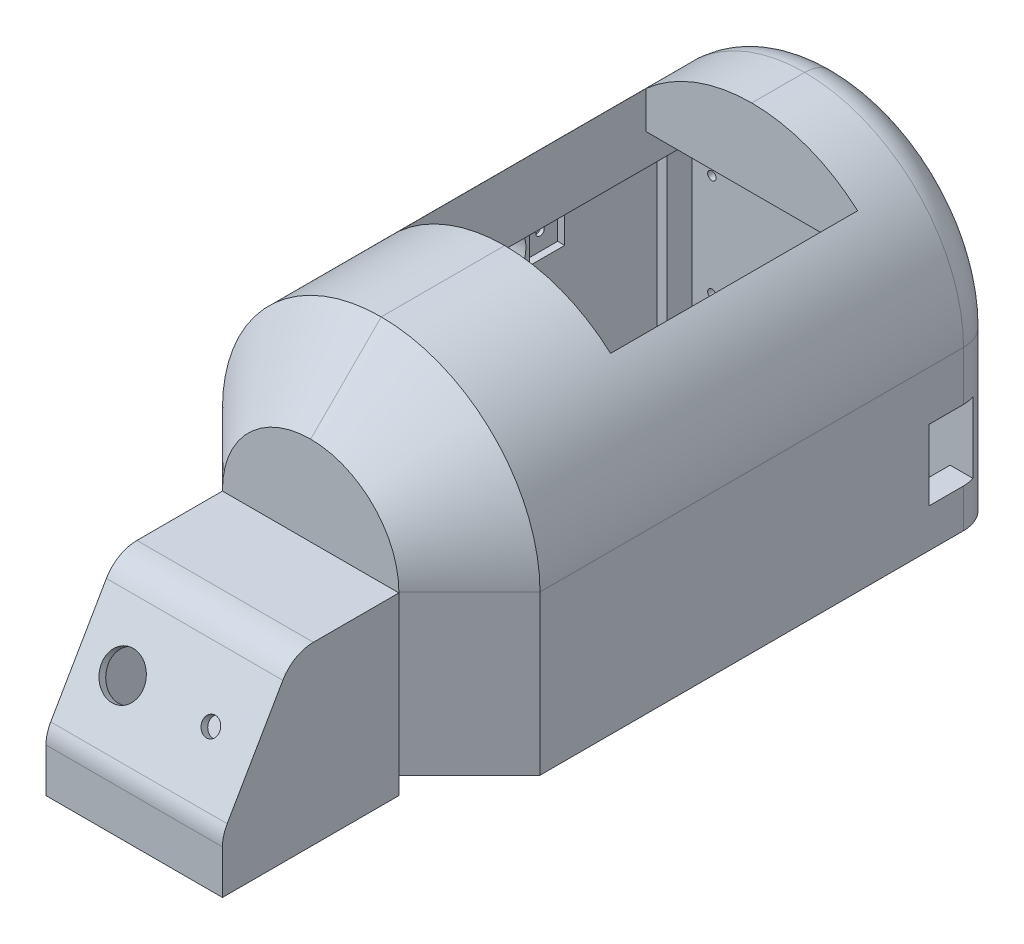
from build123d import *

# Parameters (mm, degrees)
SCHIZZO1_W                             = 90
SCHIZZO1_H                             = 150
ESTRUSIONE_ESTRUSIONE1_DEPTH           = 90
SCHIZZO4_W                             = 60
SCHIZZO4_H                             = 70
TAGLIO_ESTRUSIONE2_DEPTH               = 90
RACCORDO5_R                            = 45
RACCORDO6_R                            = 45
SMUSSO2_SIZE                           = 20
SCHIZZO7_W                             = 50
SCHIZZO7_H                             = 44.753189799
ESTRUSIONE_ESTRUSIONE2_DEPTH           = 50
SMUSSO3_SIZE                           = 20
SMUSSO3_SIZE2                          = 34.641016151
RACCORDO7_R                            = 10
RACCORDO8_R                            = 10
SCHIZZO9_W                             = 50
SCHIZZO9_H                             = 50
ESTRUSIONE_ESTRUSIONE3_DEPTH           = 5
RACCORDO9_R                            = 10
SCHIZZO13_W                            = 45
SCHIZZO13_H                            = 38.415996799
TAGLIO_ESTRUSIONE3_DEPTH               = 79.978264331
SCHIZZO14_W                            = 117.844501366
SCHIZZO14_H                            = 59.041021869
TAGLIO_ESTRUSIONE4_DEPTH               = 8
SCHIZZO18_R                            = 5
TAGLIO_ESTRUSIONE5_DEPTH               = 9
SCHIZZO16_W                            = 4
SCHIZZO16_H                            = 20
TAGLIO_ESTRUSIONE7_DEPTH               = 2
SCHIZZO23_W                            = 76
SCHIZZO23_H                            = 117.844501366
TAGLIO_ESTRUSIONE8_DEPTH               = 38
FORO_PER_VITE_M2_2_D                   = 2.4
FORO_PER_VITE_M2_2_DEPTH               = 4
FORO_PER_VITE_M4_1_D                   = 4.5
FORO_PER_VITE_M4_1_DEPTH               = 10
SCHIZZO29_W                            = 60
SCHIZZO29_H                            = 11.209863528
TAGLIO_ESTRUSIONE9_DEPTH               = 30
SCHIZZO30_W                            = 70
SCHIZZO30_H                            = 52
TAGLIO_ESTRUSIONE10_DEPTH              = 7
FORO_PER_VITE_M2_3_D                   = 2.4
FORO_PER_VITE_M2_3_DEPTH               = 4
FORO_PER_VITE_M2_3_TIP                 = 0.721032743
SCHIZZO33_W                            = 13
SCHIZZO33_H                            = 20
TAGLIO_ESTRUSIONE11_DEPTH              = 36
SCHIZZO36_W                            = 46.07976418
SCHIZZO36_H                            = 28.262497783
TAGLIO_ESTRUSIONE12_DEPTH              = 28
ESTRUSIONE_ESTRUSIONE4_REACH           = 170.388
SCHIZZO38_R                            = 6
SCHIZZO38_R_2                          = 2.5
TAGLIO_ESTRUSIONE13_DEPTH              = 28
SCHIZZO39_R                            = 9
SCHIZZO39_W                            = 10
SCHIZZO39_H                            = 10
TAGLIO_ESTRUSIONE14_DEPTH              = 2
SCHIZZO40_W                            = 32
SCHIZZO40_H                            = 10
TAGLIO_ESTRUSIONE15_DEPTH              = 10
SCHIZZO42_R                            = 4
TAGLIO_ESTRUSIONE16_DEPTH              = 3
FORO_SVASATO_PER_VITE_M2_3_D           = 2.4
FORO_SVASATO_PER_VITE_M2_3_DEPTH       = 6
FORO_SVASATO_PER_VITE_M2_3_CSINK_D     = 4.4
FORO_SVASATO_PER_VITE_M2_3_CSINK_ANGLE = 90
FORO_SVASATO_PER_VITE_M2_3_TIP         = 0.721032743
TAGLIO_ESTRUSIONE18_DEPTH              = 7
SCHIZZO53_R                            = 9
TAGLIO_ESTRUSIONE19_DEPTH              = 2.75
SCHIZZO54_W                            = 60
SCHIZZO54_H                            = 36.634637838
TAGLIO_ESTRUSIONE20_DEPTH              = 24.75


with BuildPart() as part:
    # Schizzo1 → Estrusione-Estrusione1 (new body)
    with BuildSketch(Plane(origin=(0, 0, 0), x_dir=(1, 0, 0), z_dir=(0, 1, 0))):
        Rectangle(SCHIZZO1_W, SCHIZZO1_H)
    extrude(amount=ESTRUSIONE_ESTRUSIONE1_DEPTH)

    # Schizzo4 → Taglio-Estrusione2 (cut)
    with BuildSketch(Plane(origin=(0, 90, 0), x_dir=(1, 0, 0), z_dir=(0, 1, 0))):
        with Locations((0, 15)):
            Rectangle(SCHIZZO4_W, SCHIZZO4_H)
    extrude(amount=-TAGLIO_ESTRUSIONE2_DEPTH, mode=Mode.SUBTRACT)

    # Raccordo5
    # the kernel refuses this fillet: 45 mm, written as the material it takes off along each edge
    with BuildSketch(Plane(origin=(-45, 90, -187.5), x_dir=(0, -1, 0), z_dir=(0, 0, 1))) as raccordo5_piece_1:
        with BuildLine():
            CenterArc((RACCORDO5_R, RACCORDO5_R), RACCORDO5_R, 180, 90)
            Line((0, RACCORDO5_R), (0, 0))
            Line((0, 0), (RACCORDO5_R, 0))
        make_face()
    extrude(amount=375, mode=Mode.SUBTRACT)

    # Raccordo6
    # the kernel refuses this fillet: 45 mm, written as the material it takes off along each edge
    with BuildSketch(Plane(origin=(45, 90, 187.5), x_dir=(0, -1, 0), z_dir=(0, 0, -1))) as raccordo6_piece_1:
        with BuildLine():
            CenterArc((RACCORDO6_R, RACCORDO6_R), RACCORDO6_R, 180, 90)
            Line((0, RACCORDO6_R), (0, 0))
            Line((0, 0), (RACCORDO6_R, 0))
        make_face()
    extrude(amount=375, mode=Mode.SUBTRACT)

    # Smusso2
    smusso2_edges = [part.edges().sort_by_distance(p)[0] for p in [
        (-45, 22.5, 75),
        (0, 90, 75),
        (45, 22.5, 75),
        (0, 90, 75),
    ]]
    chamfer(smusso2_edges, length=SMUSSO2_SIZE)

    # Schizzo7 → Estrusione-Estrusione2 (add)
    with BuildSketch(Plane.XY.offset(75)):
        with Locations((0, 22.3765949)):
            Rectangle(SCHIZZO7_W, SCHIZZO7_H)
    extrude(amount=ESTRUSIONE_ESTRUSIONE2_DEPTH)

    # Smusso3
    smusso3_edges = [part.edges().sort_by_distance(p)[0] for p in [
        (0, 44.753189799, 125),
    ]]
    smusso3_side = [part.faces().sort_by_distance(p)[0] for p in [
        (0, 44.753189799, 100),
    ]]
    chamfer(smusso3_edges, length=SMUSSO3_SIZE, length2=SMUSSO3_SIZE2, reference=smusso3_side[0])

    # Raccordo7
    raccordo7_edges = [part.edges().sort_by_distance(p)[0] for p in [
        (0, 44.753189799, 105),
    ]]
    fillet(raccordo7_edges, radius=RACCORDO7_R)

    # Raccordo8
    raccordo8_edges = [part.edges().sort_by_distance(p)[0] for p in [
        (0, 10.112173648, 125),
    ]]
    fillet(raccordo8_edges, radius=RACCORDO8_R)

    # Schizzo9 → Estrusione-Estrusione3 (add)
    with BuildSketch(Plane.XZ):
        with Locations((0, 100)):
            Rectangle(SCHIZZO9_W, SCHIZZO9_H)
    extrude(amount=ESTRUSIONE_ESTRUSIONE3_DEPTH)

    # Raccordo9
    raccordo9_edges = [part.edges().sort_by_distance(p)[0] for p in [
        (-45, 22.5, -75),
        (0, 90, -75),
        (45, 22.5, -75),
        (0, 90, -75),
    ]]
    fillet(raccordo9_edges, radius=RACCORDO9_R)

    # Schizzo13 → Taglio-Estrusione3 (cut)
    with BuildSketch(Plane(origin=(0, 0, 20), x_dir=(-1, 0, 0), z_dir=(0, 0, -1))):
        with Locations((0, 19.2079984)):
            Rectangle(SCHIZZO13_W, SCHIZZO13_H)
    extrude(amount=-TAGLIO_ESTRUSIONE3_DEPTH, mode=Mode.SUBTRACT)

    # Schizzo14 → Taglio-Estrusione4 (cut)
    with BuildSketch(Plane.ZY.offset(-30)):
        with Locations((-2.287612845, 29.520510935)):
            Rectangle(SCHIZZO14_W, SCHIZZO14_H)
    taglio_estrusione4 = extrude(amount=-TAGLIO_ESTRUSIONE4_DEPTH, mode=Mode.SUBTRACT)

    # Specchia1: Taglio-Estrusione4 across plane
    add(taglio_estrusione4.mirror(Plane(origin=(0, 0, 0), x_dir=(0, 0, 1), z_dir=(1, 0, 0))), mode=Mode.SUBTRACT)

    # Schizzo18 → Taglio-Estrusione5 (cut)
    with BuildSketch(Plane.ZY.offset(-30)):
        with Locations((-15, 48.541019662)):
            Circle(SCHIZZO18_R)
    extrude(amount=-TAGLIO_ESTRUSIONE5_DEPTH, mode=Mode.SUBTRACT)

    # Schizzo16 → Taglio-Estrusione7 (cut)
    with BuildSketch(Plane.XZ.offset(-59.041021869)):
        with Locations((32, -15)):
            Rectangle(SCHIZZO16_W, SCHIZZO16_H)
    extrude(amount=-TAGLIO_ESTRUSIONE7_DEPTH, mode=Mode.SUBTRACT)

    # Schizzo23 → Taglio-Estrusione8 (cut)
    with BuildSketch(Plane.XZ):
        with Locations((0, -2.287612845)):
            Rectangle(SCHIZZO23_W, SCHIZZO23_H)
    extrude(amount=-TAGLIO_ESTRUSIONE8_DEPTH, mode=Mode.SUBTRACT)

    # Foro per Vite M2-2
    with Locations(Plane(origin=(0, 0, 0), x_dir=(-1, 0, 0), z_dir=(0, -1, 0))):
        with Locations((40, 67), (30, -61.514718626), (-30, -61.514718626), (-40, 67), (-41.5, 5), (41.5, 5)):
            Hole(FORO_PER_VITE_M2_2_D / 2, depth=FORO_PER_VITE_M2_2_DEPTH)

    # Foro per Vite M4-1
    with Locations(Plane(origin=(0, -5, 84.779580177), x_dir=(0, 0, -1), z_dir=(0, -1, 0))):
        with Locations((0, 0)):
            Hole(FORO_PER_VITE_M4_1_D / 2, depth=FORO_PER_VITE_M4_1_DEPTH)

    # Schizzo29 → Taglio-Estrusione9 (cut)
    with BuildSketch(Plane.XZ.offset(-38)):
        with Locations((0, -55.604931764)):
            Rectangle(SCHIZZO29_W, SCHIZZO29_H)
    extrude(amount=-TAGLIO_ESTRUSIONE9_DEPTH, mode=Mode.SUBTRACT)

    # Schizzo30 → Taglio-Estrusione10 (cut)
    with BuildSketch(Plane.XY.offset(-61.209863528)):
        with Locations((3, 29.778767455)):
            Rectangle(SCHIZZO30_W, SCHIZZO30_H)
    extrude(amount=-TAGLIO_ESTRUSIONE10_DEPTH, mode=Mode.SUBTRACT)

    # Foro per Vite M2-3
    with Locations(Plane.XY.offset(-68.209863528)):
        with Locations((-29.5, 48.278767455), (-29.5, 19.278767455), (22.5, 6.278767455), (22.5, 53.278767455)):
            Hole(FORO_PER_VITE_M2_3_D / 2, depth=FORO_PER_VITE_M2_3_DEPTH)
            with Locations((0, 0, -(FORO_PER_VITE_M2_3_DEPTH + FORO_PER_VITE_M2_3_TIP / 2))):  # 118° drill point
                Cone(0, FORO_PER_VITE_M2_3_D / 2, FORO_PER_VITE_M2_3_TIP, mode=Mode.SUBTRACT)

    # Schizzo33 → Taglio-Estrusione11 (cut)
    with BuildSketch(Plane.ZY.offset(-38)):
        with Locations((-61.709863528, 21)):
            Rectangle(SCHIZZO33_W, SCHIZZO33_H)
    extrude(amount=-TAGLIO_ESTRUSIONE11_DEPTH, mode=Mode.SUBTRACT)

    # Schizzo36 → Taglio-Estrusione12 (cut)
    with BuildSketch(Plane(origin=(0, 56.654631148, 98.128699633), x_dir=(1, 0, 0), z_dir=(0, 0.5000000000000012, 0.8660254037844378))):
        with Locations((0, -35.289606117)):
            Rectangle(SCHIZZO36_W, SCHIZZO36_H)
    extrude(amount=-TAGLIO_ESTRUSIONE12_DEPTH, mode=Mode.SUBTRACT)

    # Schizzo37 → Estrusione-Estrusione4 (add, up to next)
    with BuildSketch(Plane.ZY.offset(-23.03988209), mode=Mode.PRIVATE) as estrusione_estrusione4_sk1:
        Polygon((122.839127138, 13.854915234), (108.707878246, 38.330956288), (106.809101084, 37.234696782), (120.940349975, 12.758655728), align=None)
    estrusione_estrusione4_tool1 = extrude(estrusione_estrusione4_sk1.sketch, amount=ESTRUSIONE_ESTRUSIONE4_REACH, mode=Mode.PRIVATE) - part.part
    add(estrusione_estrusione4_tool1.solids().sort_by_distance((23.039882, 25.544806, 114.824114))[0])

    # Schizzo38 → Taglio-Estrusione13 (cut)
    with BuildSketch(Plane(origin=(0, 56.654631148, 98.128699633), x_dir=(1, 0, 0), z_dir=(0, 0.5000000000000013, 0.8660254037844379))):
        with Locations(Location((-12.5, -35.289606117, 0), (0, 0, 270))):
            Circle(SCHIZZO38_R)
        with Locations(Location((12.5, -35.289606117, 0), (0, 0, 270))):
            Circle(SCHIZZO38_R_2)
    extrude(amount=-TAGLIO_ESTRUSIONE13_DEPTH, mode=Mode.SUBTRACT)

    # Schizzo39 → Taglio-Estrusione14 (cut)
    with BuildSketch(Plane(origin=(-38, 0, 0), x_dir=(0, 0, -1), z_dir=(1, 0, 0))):
        with Locations(Location((15, 48.541019662, 0), (0, 0, 90))):
            Circle(SCHIZZO39_R)
        with Locations((0, 48.541019662)):
            Rectangle(SCHIZZO39_W, SCHIZZO39_H)
        with Locations((30, 48.541019662)):
            Rectangle(SCHIZZO39_W, SCHIZZO39_H)
    extrude(amount=-TAGLIO_ESTRUSIONE14_DEPTH, mode=Mode.SUBTRACT)

    # Schizzo40 → Taglio-Estrusione15 (cut)
    with BuildSketch(Plane.ZY.offset(45)):
        with Locations((38, 10)):
            Rectangle(SCHIZZO40_W, SCHIZZO40_H)
    extrude(amount=-TAGLIO_ESTRUSIONE15_DEPTH, mode=Mode.SUBTRACT)

    # Schizzo42 → Taglio-Estrusione16 (cut)
    with BuildSketch(Plane.ZY.offset(45)):
        with Locations((-30, 48.541019662)):
            Circle(SCHIZZO42_R)
        with Locations((0, 48.541019662)):
            Circle(SCHIZZO42_R)
    extrude(amount=-TAGLIO_ESTRUSIONE16_DEPTH, mode=Mode.SUBTRACT)

    # Foro svasato per Vite M2-3
    with Locations(Plane.ZY.offset(42)):
        with Locations((-30, 48.541019662), (0, 48.541019662)):
            CounterSinkHole(FORO_SVASATO_PER_VITE_M2_3_D / 2, FORO_SVASATO_PER_VITE_M2_3_CSINK_D / 2, depth=FORO_SVASATO_PER_VITE_M2_3_DEPTH, counter_sink_angle=FORO_SVASATO_PER_VITE_M2_3_CSINK_ANGLE)
            with Locations((0, 0, -(FORO_SVASATO_PER_VITE_M2_3_DEPTH + FORO_SVASATO_PER_VITE_M2_3_TIP / 2))):  # 118° drill point
                Cone(0, FORO_SVASATO_PER_VITE_M2_3_D / 2, FORO_SVASATO_PER_VITE_M2_3_TIP, mode=Mode.SUBTRACT)

    # Schizzo50 → Taglio-Estrusione18 (cut)
    with BuildSketch(Plane.XY.offset(-61.209863528)):
        Polygon((38, 59.041021869), (38, 55.778767455), (-32, 55.778767455), (-32, 3.778767455), (-35.181345979, 3.778767455), (-35.181345979, 59.041021869), align=None)
    extrude(amount=-TAGLIO_ESTRUSIONE18_DEPTH, mode=Mode.SUBTRACT)

    # Schizzo53 → Taglio-Estrusione19 (cut)
    with BuildSketch(Plane(origin=(-40, 0, 0), x_dir=(0, 0, -1), z_dir=(1, 0, 0))):
        with Locations(Location((15, 48.541019662, 0), (0, 0, 90))):
            Circle(SCHIZZO53_R)
    extrude(amount=-TAGLIO_ESTRUSIONE19_DEPTH, mode=Mode.SUBTRACT)

    # Schizzo54 → Taglio-Estrusione20 (cut)
    with BuildSketch(Plane.XZ.offset(-38)):
        with Locations((0, 38.317318919)):
            Rectangle(SCHIZZO54_W, SCHIZZO54_H)
    extrude(amount=-TAGLIO_ESTRUSIONE20_DEPTH, mode=Mode.SUBTRACT)


solid = part.part
